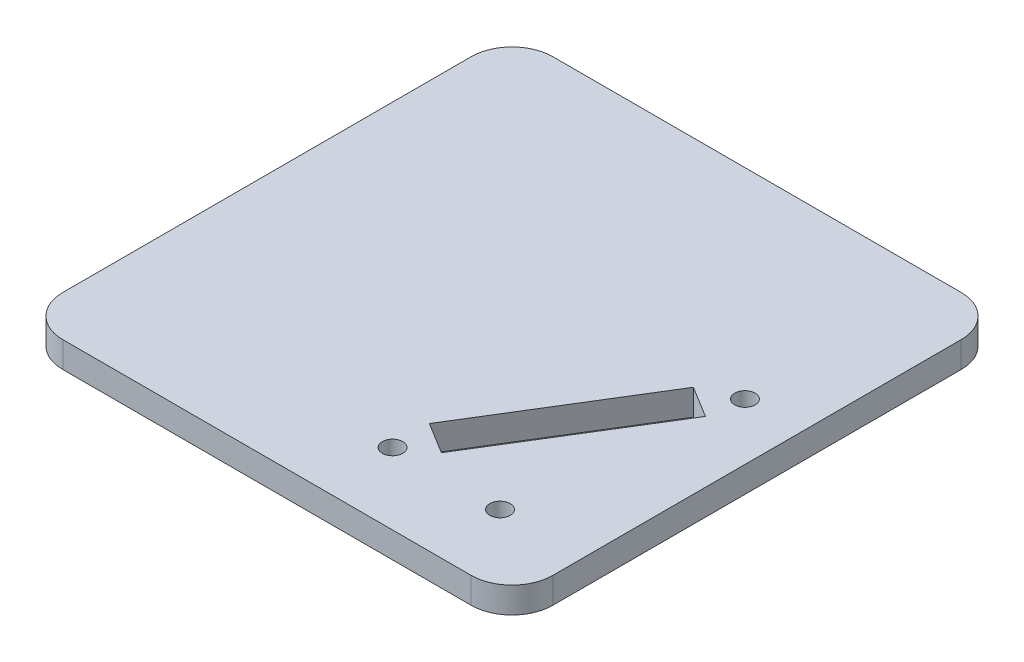
from build123d import *

# Parameters (mm, degrees)
BOSS_EXTRUDE1_DEPTH = 6.35
SKETCH2_R           = 2.5
CUT_EXTRUDE1_DEPTH  = 170.824387236


with BuildPart() as part:
    # Sketch1 → Boss-Extrude1 (new body)
    with BuildSketch(Plane(origin=(0, 0, 0), x_dir=(1, 0, 0), z_dir=(0, 1, 0))):
        with BuildLine():
            Line((10, 0), (110, 0))
            ThreePointArc((110, 0), (117.071067812, 2.928932188), (120, 10))
            Line((120, 10), (120, 110))
            ThreePointArc((120, 110), (117.071067812, 117.071067812), (110, 120))
            Line((110, 120), (10, 120))
            ThreePointArc((10, 120), (2.928932188, 117.071067812), (0, 110))
            Line((0, 110), (0, 10))
            ThreePointArc((0, 10), (2.928932188, 2.928932188), (10, 0))
        make_face()
    extrude(amount=BOSS_EXTRUDE1_DEPTH)

    # Sketch2 → Cut-Extrude1 (cut, through all)
    with BuildSketch(Plane(origin=(0, 6.35, 0), x_dir=(1, 0, 0), z_dir=(0, 1, 0))):
        with Locations((73.247106426, 17.5)):
            Circle(SKETCH2_R)
        with Locations((99.561621258, 17.5)):
            Circle(SKETCH2_R)
        with Locations((106.121563136, 70.926439205)):
            Circle(SKETCH2_R)
        Polygon((72.684832441, 27.081219791), (80.349971943, 22.364691786), (104.980729303, 62.393753627), (97.315589801, 67.110281632), align=None)
    extrude(amount=-CUT_EXTRUDE1_DEPTH, mode=Mode.SUBTRACT)


solid = part.part
